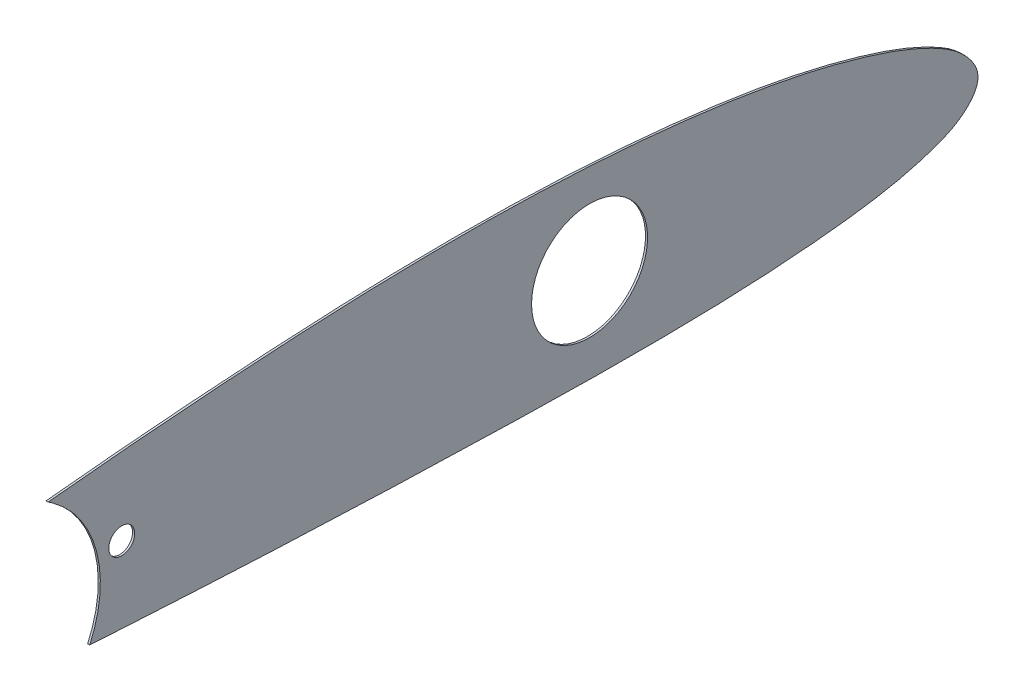
from build123d import *

# Parameters (mm, degrees)
SKETCH1_R           = 11.2
SKETCH1_R_2         = 2.5
BOSS_EXTRUDE1_DEPTH = 0.4


with BuildPart() as part:
    # Sketch1 → Boss-Extrude1 (new body)
    with BuildSketch(Plane.ZY.offset(-899)):
        with BuildLine():
            Line((164.120946345, -9.231663281), (166.517804038, -9.091301062))
            add(Edge.make_bspline(
                [(166.517804038, -9.091301062), (168.182005341, -8.993323819), (169.846147237, -8.894309143), (171.510243556, -8.794521134)],
                knots=[0.210464417, 0.210464417, 0.210464417, 0.210464417, 0.21863886, 0.21863886, 0.21863886, 0.21863886], degree=3))
            ThreePointArc((171.510243556, -8.794521134), (170.149334223, 6.071124871), (178.526126507, 18.427048811))
            ThreePointArc((178.526126507, 18.427048811), (179.029209678, 18.784182215), (179.541699574, 19.127259062))
            add(Edge.make_bspline(
                [(179.541699574, 19.127259062), (169.708345912, 20.138854057), (149.879925079, 21.867658214), (120.026341518, 23.635097209), (94.990664557, 23.935808407), (74.981855474, 23.107465721), (59.962978235, 21.893704318), (44.925139834, 19.97163417), (32.409919206, 17.604753461), (22.432539712, 14.926973956), (14.868276975, 12.492476274), (8.45946997, 9.655920822), (2.931290987, 6.216911108), (-1.889468689, 0.269631354), (3.118016179, -4.957920198), (8.542791775, -7.342160266), (14.923403388, -9.153243486), (22.462762474, -10.451795047), (32.480073396, -11.559964158), (44.984109362, -12.412907572), (59.998233621, -12.754877712), (75.001642297, -12.707223024), (95.003495515, -12.26571363), (120.008146035, -11.471242967), (144.712930758, -10.332736542), (159.414596639, -9.505743263), (164.120946345, -9.231663281)],
                knots=[0.22256319, 0.22256319, 0.22256319, 0.22256319, 0.27103422, 0.320145624, 0.369181771, 0.393720675, 0.418320253, 0.443043845, 0.468027625, 0.480718869, 0.493635455, 0.507108458, 0.51449317, 0.526687903, 0.536838179, 0.54368004, 0.556464437, 0.568920089, 0.581260934, 0.605838217, 0.630363791, 0.65488113, 0.679403322, 0.728462999, 0.777549428, 0.800665859, 0.800665859, 0.800665859, 0.800665859], degree=3))
        make_face()
        with Locations((74.982510175, 5.540475164)):
            Circle(SKETCH1_R, mode=Mode.SUBTRACT)
        with Locations((165.319375135, 5.540475164)):
            Circle(SKETCH1_R_2, mode=Mode.SUBTRACT)
    extrude(amount=-BOSS_EXTRUDE1_DEPTH)


solid = part.part
